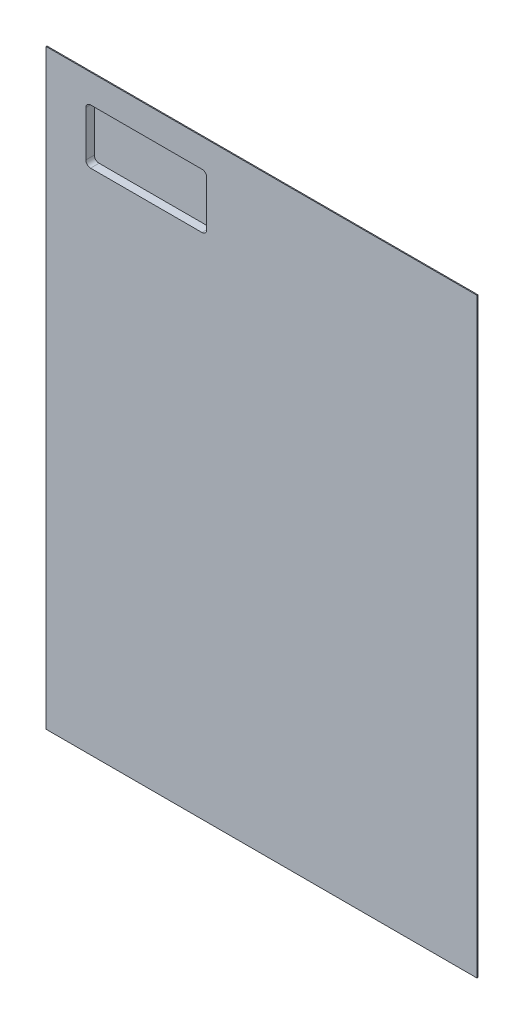
from build123d import *

# Parameters (mm, degrees)
SKETCH1_W           = 456
SKETCH1_H           = 626
BASE_FLANGE1_DEPTH  = 1
SKETCH6_W           = 130
SKETCH6_H           = 60
BOSS_EXTRUDE1_DEPTH = 10
SKETCH7_W           = 128
SKETCH7_H           = 58
CUT_EXTRUDE2_DEPTH  = 1
SHELL2_START        = -186
SHELL2_OUTLINE_W    = 58
SHELL2_OUTLINE_H    = 8
SHELL2_DEPTH        = 128
FILLET1_R           = 5


# Read off the part's stored shape, not the designer's step: Shell2
# Sheet-metal steps are written as plain solids
with BuildPart() as part:
    # Sketch1 → Base-Flange1 (new body)
    with BuildSketch(Plane.XY):
        Rectangle(SKETCH1_W, SKETCH1_H)
    extrude(amount=-BASE_FLANGE1_DEPTH)

    # Sketch6 → Boss-Extrude1 (add)
    with BuildSketch(Plane.XY):
        with Locations((-122, 254)):
            Rectangle(SKETCH6_W, SKETCH6_H)
    extrude(amount=-BOSS_EXTRUDE1_DEPTH)

    # Sketch7 → Cut-Extrude2 (cut)
    with BuildSketch(Plane.XY):
        with Locations((-122, 254)):
            Rectangle(SKETCH7_W, SKETCH7_H)
    extrude(amount=-CUT_EXTRUDE2_DEPTH, mode=Mode.SUBTRACT)

    # Shell2 outline → Shell2 (cut)
    with BuildSketch(Plane.YZ.offset(SHELL2_START)):
        with Locations((254, -5)):
            Rectangle(SHELL2_OUTLINE_W, SHELL2_OUTLINE_H)
    extrude(amount=SHELL2_DEPTH, mode=Mode.SUBTRACT)

    # Fillet1
    fillet1_edges = [part.edges().sort_by_distance(p)[0] for p in [
        (-57, 284, -5.5),
        (-57, 224, -5.5),
        (-187, 224, -5.5),
        (-187, 284, -5.5),
        (-186, 225, -4.5),
        (-186, 283, -4.5),
        (-58, 283, -4.5),
        (-58, 225, -4.5),
    ]]
    fillet(fillet1_edges, radius=FILLET1_R)


solid = part.part
